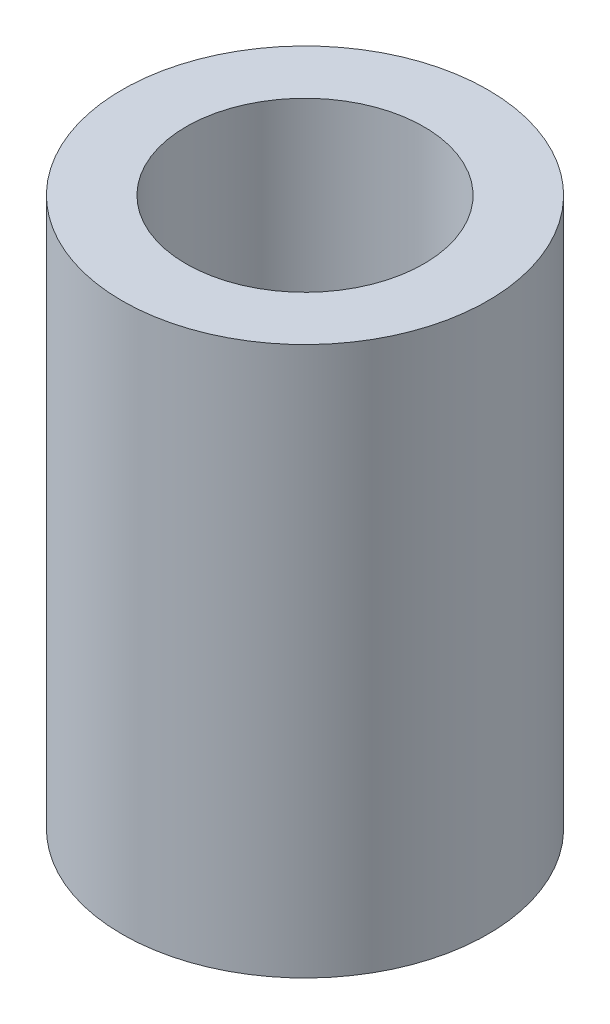
from build123d import *

# Parameters (mm, degrees)
SKETCH1_R           = 5
SKETCH1_R_2         = 3.25
BOSS_EXTRUDE1_DEPTH = 15


with BuildPart() as part:
    # Sketch1 → Boss-Extrude1 (new body)
    with BuildSketch(Plane(origin=(0, 0, 0), x_dir=(1, 0, 0), z_dir=(0, 1, 0))):
        Circle(SKETCH1_R)
        Circle(SKETCH1_R_2, mode=Mode.SUBTRACT)
    extrude(amount=BOSS_EXTRUDE1_DEPTH)


solid = part.part
